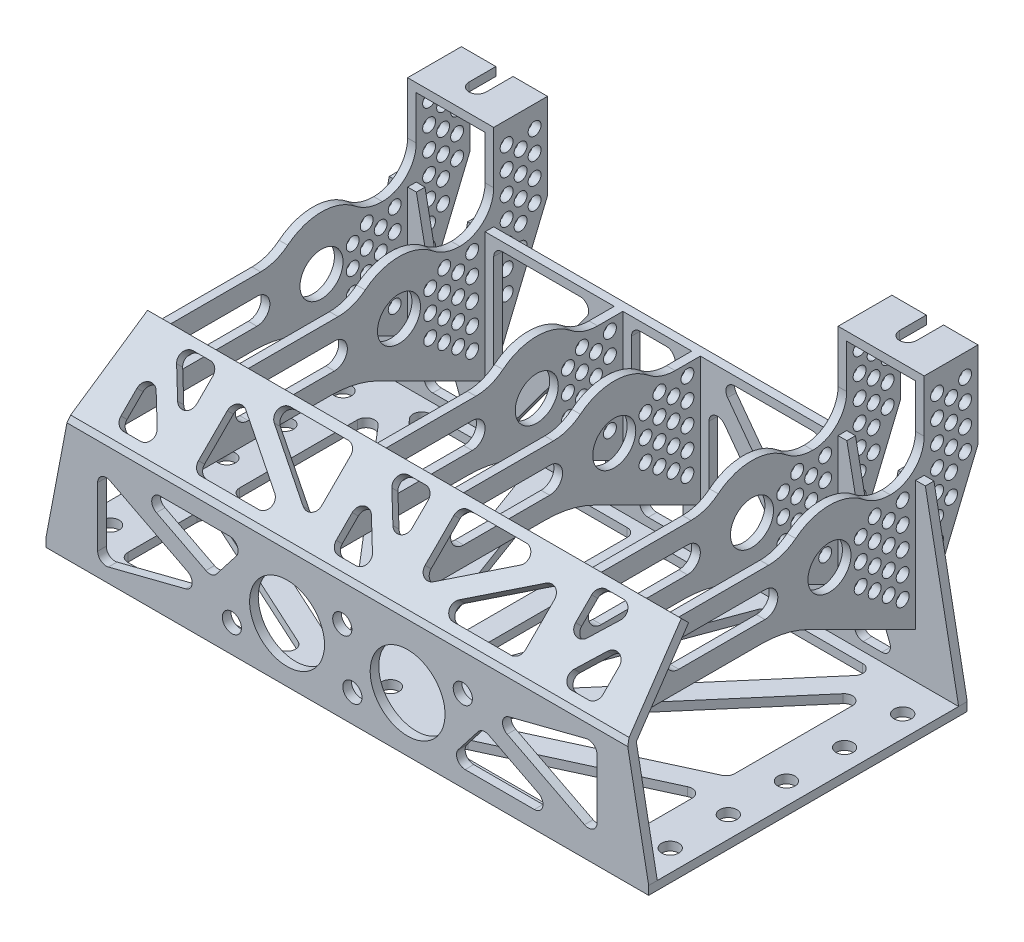
from build123d import *

# Parameters (mm, degrees)
BOSS_EXTRUDE1_START      = 16
SKETCH1_R                = 10
BOSS_EXTRUDE1_DEPTH      = 4
SKETCH2_W                = 280
SKETCH2_H                = 85
BOSS_EXTRUDE2_DEPTH      = 4
SKETCH3_R                = 17.4
CUT_EXTRUDE1_DEPTH       = 10
SKETCH4_R                = 17.4
SKETCH4_R_2              = 4.45
CUT_EXTRUDE2_DEPTH       = 10
LPATTERN2_COUNT          = 2
LPATTERN2_PITCH          = 64
LPATTERN2_COL_COUNT      = 2
LPATTERN2_COL_PITCH      = 100
BOSS_EXTRUDE3_START      = 32
SKETCH5_R                = 10
BOSS_EXTRUDE3_DEPTH      = 4
BOSS_EXTRUDE4_START      = 36
SKETCH6_R                = 10
BOSS_EXTRUDE4_DEPTH      = 4
CUT_EXTRUDE3_DEPTH       = 188.92551716
CUT_EXTRUDE3_DEPTH_BACK  = 188.92551716
BOSS_EXTRUDE5_DEPTH      = 140
SKETCH9_W                = 280
SKETCH9_H                = 85
BOSS_EXTRUDE6_DEPTH      = 4
SKETCH10_W               = 280
SKETCH10_H               = 148
BOSS_EXTRUDE7_DEPTH      = 4
CUT_EXTRUDE4_DEPTH       = 4
CUT_EXTRUDE5_DEPTH       = 4
CUT_EXTRUDE6_DEPTH       = 4
SKETCH14_R               = 4
CUT_EXTRUDE7_DEPTH       = 4
CUT_EXTRUDE8_DEPTH       = 10
BOSS_EXTRUDE8_START      = 80
SKETCH16_R               = 3
BOSS_EXTRUDE8_DEPTH      = 4
LPATTERN3_COUNT          = 2
LPATTERN3_PITCH          = 36
BOSS_EXTRUDE9_DEPTH      = 4
MIRROR2_START            = 80
MIRROR2_COPY_1_SKETCH_R  = 3
MIRROR2_COPY_1_DEPTH     = 4
CUT_EXTRUDE9_DEPTH       = 188.92551716
CUT_EXTRUDE9_DEPTH_BACK  = 188.92551716
SKETCH18_R               = 3
CUT_EXTRUDE10_DEPTH      = 188.92551716
CUT_EXTRUDE10_DEPTH_BACK = 188.92551716


with BuildPart() as part:
    # Sketch1 → Boss-Extrude1 (new body)
    with BuildSketch(Plane(origin=(0, 0, 0), x_dir=(0, 0, -1), z_dir=(1, 0, 0)).offset(BOSS_EXTRUDE1_START)):
        with BuildLine():
            Line((40, 15), (28.284271247, 15))
            ThreePointArc((28.284271247, 15), (21.617604581, 16.143819168), (15.713484026, 19.444444444))
            ThreePointArc((15.713484026, 19.444444444), (0, 25), (-15.713484026, 19.444444444))
            ThreePointArc((-15.713484026, 19.444444444), (-21.617604581, 16.143819168), (-28.284271247, 15))
            Line((-28.284271247, 15), (-100, 15))
            Line((-100, 15), (-100, -15))
            Line((-100, -15), (-31.803398875, -15))
            ThreePointArc((-31.803398875, -15), (-20.315752848, -16.337550527), (-9.4427191, -20.27864045))
            Line((-9.4427191, -20.27864045), (40, -45))
            Line((40, -45), (40, -15))
            Line((40, -15), (40, 15))
        make_face()
        Circle(SKETCH1_R, mode=Mode.SUBTRACT)
        with BuildLine():
            Line((-30, -6), (-60, -6))
            ThreePointArc((-60, -6), (-66, 0), (-60, 6))
            Line((-60, 6), (-30, 6))
            ThreePointArc((-30, 6), (-24, 0), (-30, -6))
        make_face(mode=Mode.SUBTRACT)
    boss_extrude1 = extrude(amount=BOSS_EXTRUDE1_DEPTH)


with BuildPart() as body_2:
    # Mirror1: mirrored copy
    add(part.part.mirror(Plane(origin=(0, 0, 0), x_dir=(0, 0, 1), z_dir=(1, 0, 0))))


with BuildPart() as part_1:
    add(part.part)

    add(body_2.part)  # Boss-Extrude2 merges body 2
    # Sketch2 → Boss-Extrude2 (add)
    with BuildSketch(Plane.XY.offset(100)):
        with Locations((0, -27.5)):
            Rectangle(SKETCH2_W, SKETCH2_H)
    extrude(amount=BOSS_EXTRUDE2_DEPTH)

    # Sketch3 → Cut-Extrude1 (cut)
    with BuildSketch(Plane.XY.offset(104)):
        with Locations((-28, -44.5)):
            Circle(SKETCH3_R)
        with Locations(Location((28, -44.5, 0), (0, 0, 180))):
            Circle(SKETCH3_R)
    extrude(amount=-CUT_EXTRUDE1_DEPTH, mode=Mode.SUBTRACT)

    # Sketch4 → Cut-Extrude2 (cut)
    with BuildSketch(Plane.XY.offset(104)):
        with Locations(Location((28, -44.5, 0), (0, 0, 180))):
            Circle(SKETCH4_R)
        with Locations((-28, -44.5)):
            Circle(SKETCH4_R)
        with Locations((-53.64371268, -57.05)):
            Circle(SKETCH4_R_2)
        with Locations((-2.35628732, -31.95)):
            Circle(SKETCH4_R_2)
        with Locations((2.35628732, -57.05)):
            Circle(SKETCH4_R_2)
        with Locations((53.64371268, -31.95)):
            Circle(SKETCH4_R_2)
    extrude(amount=-CUT_EXTRUDE2_DEPTH, mode=Mode.SUBTRACT)

    # LPattern2: Boss-Extrude1 ×2
    with Locations(*[(i * LPATTERN2_PITCH, 0, 0) for i in range(1, LPATTERN2_COUNT)]):
        add(boss_extrude1)

    # LPattern2 col: Boss-Extrude1 ×2
    with Locations(*[(-i * LPATTERN2_COL_PITCH, 0, 0) for i in range(1, LPATTERN2_COL_COUNT)]):
        add(boss_extrude1)

    # Sketch5 → Boss-Extrude3 (add)
    with BuildSketch(Plane(origin=(84, 0, 0), x_dir=(0, 0, -1), z_dir=(1, 0, 0)).offset(BOSS_EXTRUDE3_START)):
        with BuildLine():
            Line((40, -45), (40, 15))
            Line((40, 15), (28.284271247, 15))
            ThreePointArc((28.284271247, 15), (21.617604581, 16.143819168), (15.713484026, 19.444444444))
            ThreePointArc((15.713484026, 19.444444444), (0, 25), (-15.713484026, 19.444444444))
            ThreePointArc((-15.713484026, 19.444444444), (-21.617604581, 16.143819168), (-28.284271247, 15))
            Line((-28.284271247, 15), (-100, 15))
            Line((-100, 15), (-100, -15))
            Line((-100, -15), (-31.803398875, -15))
            ThreePointArc((-31.803398875, -15), (-20.315752848, -16.337550527), (-9.4427191, -20.27864045))
            Line((-9.4427191, -20.27864045), (40, -45))
        make_face()
        Circle(SKETCH5_R, mode=Mode.SUBTRACT)
        with BuildLine():
            Line((-60, -6), (-30, -6))
            ThreePointArc((-30, -6), (-24, 0), (-30, 6))
            Line((-30, 6), (-60, 6))
            ThreePointArc((-60, 6), (-66, 0), (-60, -6))
        make_face(mode=Mode.SUBTRACT)
    extrude(amount=BOSS_EXTRUDE3_DEPTH)

    # Sketch6 → Boss-Extrude4 (add)
    with BuildSketch(Plane.ZY.offset(84).offset(BOSS_EXTRUDE4_START)):
        with BuildLine():
            Line((-40, 15), (-40, -45))
            Line((-40, -45), (9.4427191, -20.27864045))
            ThreePointArc((9.4427191, -20.27864045), (20.315752848, -16.337550527), (31.803398875, -15))
            Line((31.803398875, -15), (100, -15))
            Line((100, -15), (100, 15))
            Line((100, 15), (28.284271247, 15))
            ThreePointArc((28.284271247, 15), (21.617604581, 16.143819168), (15.713484026, 19.444444444))
            ThreePointArc((15.713484026, 19.444444444), (0, 25), (-15.713484026, 19.444444444))
            ThreePointArc((-15.713484026, 19.444444444), (-21.617604581, 16.143819168), (-28.284271247, 15))
            Line((-28.284271247, 15), (-40, 15))
        make_face()
        with Locations(Location((0, 0, 0), (0, 0, 180))):
            Circle(SKETCH6_R, mode=Mode.SUBTRACT)
        with BuildLine():
            Line((30, 6), (60, 6))
            ThreePointArc((60, 6), (66, 0), (60, -6))
            Line((60, -6), (30, -6))
            ThreePointArc((30, -6), (24, 0), (30, 6))
        make_face(mode=Mode.SUBTRACT)
    extrude(amount=-BOSS_EXTRUDE4_DEPTH)

    # Sketch7 → Cut-Extrude3 (cut, two sides: drawn at the far end of the back side and taken through both)
    with BuildSketch(Plane(origin=(0, 0, 0), x_dir=(0, 0, -1), z_dir=(1, 0, 0)).offset(-CUT_EXTRUDE3_DEPTH_BACK)):
        Polygon((-100, -15), (-70, 15), (-68.891417533, 31.702063233), (-121.475487847, 31.702063233), (-121.475487847, -15), align=None)
    extrude(amount=CUT_EXTRUDE3_DEPTH + CUT_EXTRUDE3_DEPTH_BACK, mode=Mode.SUBTRACT)


with BuildPart() as cut_extrude3_piece_1:
    # of the separate pieces the step leaves, piece 1, a body of its own (cut_extrude3_pieces)
    add(part_1.part.solids().sort_by_distance((-140, -15, 100))[0])



with BuildPart() as cut_extrude3_piece_2:
    # of the separate pieces the step leaves, piece 2, a body of its own (cut_extrude3_pieces)
    add(part_1.part.solids().sort_by_distance((-120, 15, 70))[0])


with BuildPart() as cut_extrude3_piece_3:
    # of the separate pieces the step leaves, piece 3, a body of its own (cut_extrude3_pieces)
    add(part_1.part.solids().sort_by_distance((16, 15, 70))[0])


with BuildPart() as cut_extrude3_piece_4:
    # of the separate pieces the step leaves, piece 4, a body of its own (cut_extrude3_pieces)
    add(part_1.part.solids().sort_by_distance((80, 15, 70))[0])


with BuildPart() as cut_extrude3_piece_5:
    # of the separate pieces the step leaves, piece 5, a body of its own (cut_extrude3_pieces)
    add(part_1.part.solids().sort_by_distance((-84, 15, 28.284271247))[0])


with BuildPart() as cut_extrude3_piece_6:
    # of the separate pieces the step leaves, piece 6, a body of its own (cut_extrude3_pieces)
    add(part_1.part.solids().sort_by_distance((-20, 15, 28.284271247))[0])


with BuildPart() as cut_extrude3_piece_7:
    # of the separate pieces the step leaves, piece 7, a body of its own (cut_extrude3_pieces)
    add(part_1.part.solids().sort_by_distance((116, 15, 70))[0])


with BuildPart() as cut_extrude3_piece_1_1:
    add(cut_extrude3_piece_1.part)

    add(cut_extrude3_piece_2.part)  # Boss-Extrude5 merges Cut-Extrude3 piece 2

    add(cut_extrude3_piece_3.part)  # Boss-Extrude5 merges Cut-Extrude3 piece 3

    add(cut_extrude3_piece_4.part)  # Boss-Extrude5 merges Cut-Extrude3 piece 4

    add(cut_extrude3_piece_5.part)  # Boss-Extrude5 merges Cut-Extrude3 piece 5

    add(cut_extrude3_piece_6.part)  # Boss-Extrude5 merges Cut-Extrude3 piece 6

    add(cut_extrude3_piece_7.part)  # Boss-Extrude5 merges Cut-Extrude3 piece 7
    # Sketch8 → Boss-Extrude5 (add, symmetric)
    with BuildSketch(Plane(origin=(0, 0, 0), x_dir=(0, 0, -1), z_dir=(1, 0, 0))):
        Polygon((-100, -15), (-70, 15), (-72.828427125, 17.828427125), (-102.828427125, -12.171572875), (-104, -15), align=None)
    extrude(amount=BOSS_EXTRUDE5_DEPTH, both=True)

    # Sketch9 → Boss-Extrude6 (add)
    with BuildSketch(Plane(origin=(0, 0, -40), x_dir=(-1, 0, 0), z_dir=(0, 0, -1))):
        with Locations((0, -27.5)):
            Rectangle(SKETCH9_W, SKETCH9_H)
    extrude(amount=BOSS_EXTRUDE6_DEPTH)

    # Sketch10 → Boss-Extrude7 (add)
    with BuildSketch(Plane.XZ.offset(70)):
        with Locations((0, 30)):
            Rectangle(SKETCH10_W, SKETCH10_H)
    extrude(amount=-BOSS_EXTRUDE7_DEPTH)

    # Sketch11 → Cut-Extrude4 (cut)
    with BuildSketch(Plane(origin=(0, 45.328427125, 45.328427125), x_dir=(1, 0, 0), z_dir=(0, 0.7071067811865476, 0.7071067811865475))):
        with BuildLine():
            Line((-69.690598923, -51.079699862), (-42.860713883, -70.051293513))
            ThreePointArc((-42.860713883, -70.051293513), (-41.358032504, -74.528901623), (-45.17011496, -77.317279836))
            Line((-45.17011496, -77.317279836), (-72, -77.317279836))
            ThreePointArc((-72, -77.317279836), (-74.828427125, -76.145706961), (-76, -73.317279836))
            Line((-76, -73.317279836), (-76, -54.345686186))
            ThreePointArc((-76, -54.345686186), (-73.838803374, -50.79339085), (-69.690598923, -51.079699862))
        make_face()
        with BuildLine():
            Line((-57.139286117, -50.156859289), (-30.309401077, -69.12845294))
            ThreePointArc((-30.309401077, -69.12845294), (-26.161196626, -69.414761952), (-24, -65.862466616))
            Line((-24, -65.862466616), (-24, -46.890872965))
            ThreePointArc((-24, -46.890872965), (-25.171572875, -44.062445841), (-28, -42.890872965))
            Line((-28, -42.890872965), (-54.82988504, -42.890872965))
            ThreePointArc((-54.82988504, -42.890872965), (-58.641967496, -45.679251179), (-57.139286117, -50.156859289))
        make_face()
        with BuildLine():
            Line((76, -54.345686186), (76, -73.317279836))
            ThreePointArc((76, -73.317279836), (74.828427125, -76.145706961), (72, -77.317279836))
            Line((72, -77.317279836), (45.17011496, -77.317279836))
            ThreePointArc((45.17011496, -77.317279836), (41.358032504, -74.528901623), (42.860713883, -70.051293513))
            Line((42.860713883, -70.051293513), (69.690598923, -51.079699862))
            ThreePointArc((69.690598923, -51.079699862), (73.838803374, -50.79339085), (76, -54.345686186))
        make_face()
        with BuildLine():
            Line((57.139286117, -50.156859289), (30.309401077, -69.12845294))
            ThreePointArc((30.309401077, -69.12845294), (26.161196626, -69.414761952), (24, -65.862466616))
            Line((24, -65.862466616), (24, -46.890872965))
            ThreePointArc((24, -46.890872965), (25.171572875, -44.062445841), (28, -42.890872965))
            Line((28, -42.890872965), (54.82988504, -42.890872965))
            ThreePointArc((54.82988504, -42.890872965), (58.641967496, -45.679251179), (57.139286117, -50.156859289))
        make_face()
        with BuildLine():
            Line((-112, -62.782804939), (-112, -73.317279836))
            ThreePointArc((-112, -73.317279836), (-110.828427125, -76.145706961), (-108, -77.317279836))
            Line((-108, -77.317279836), (-100.054401454, -77.317279836))
            ThreePointArc((-100.054401454, -77.317279836), (-96.474269676, -75.101279963), (-96.860923682, -70.908608062))
            Line((-96.860923682, -70.908608062), (-104.806522228, -60.374133164))
            ThreePointArc((-104.806522228, -60.374133164), (-109.270056871, -58.989790894), (-112, -62.782804939))
        make_face()
        with BuildLine():
            Line((-88, -46.890872965), (-88, -57.425347863))
            ThreePointArc((-88, -57.425347863), (-90.729943129, -61.218361908), (-95.193477772, -59.834019637))
            Line((-95.193477772, -59.834019637), (-103.139076318, -49.29954474))
            ThreePointArc((-103.139076318, -49.29954474), (-103.525730324, -45.106872839), (-99.945598546, -42.890872965))
            Line((-99.945598546, -42.890872965), (-92, -42.890872965))
            ThreePointArc((-92, -42.890872965), (-89.171572875, -44.062445841), (-88, -46.890872965))
        make_face()
        with BuildLine():
            Line((96.860923682, -70.908608062), (104.806522228, -60.374133164))
            ThreePointArc((104.806522228, -60.374133164), (109.270056871, -58.989790894), (112, -62.782804939))
            Line((112, -62.782804939), (112, -73.317279836))
            ThreePointArc((112, -73.317279836), (110.828427125, -76.145706961), (108, -77.317279836))
            Line((108, -77.317279836), (100.054401454, -77.317279836))
            ThreePointArc((100.054401454, -77.317279836), (96.474269676, -75.101279963), (96.860923682, -70.908608062))
        make_face()
        with BuildLine():
            Line((95.193477772, -59.834019637), (103.139076318, -49.29954474))
            ThreePointArc((103.139076318, -49.29954474), (103.525730324, -45.106872839), (99.945598546, -42.890872965))
            Line((99.945598546, -42.890872965), (92, -42.890872965))
            ThreePointArc((92, -42.890872965), (89.171572875, -44.062445841), (88, -46.890872965))
            Line((88, -46.890872965), (88, -57.425347863))
            ThreePointArc((88, -57.425347863), (90.729943129, -61.218361908), (95.193477772, -59.834019637))
        make_face()
        with BuildLine():
            Line((12, -46.890872965), (12, -57.425347863))
            ThreePointArc((12, -57.425347863), (9.270056871, -61.218361908), (4.806522228, -59.834019637))
            Line((4.806522228, -59.834019637), (-3.139076318, -49.29954474))
            ThreePointArc((-3.139076318, -49.29954474), (-3.525730324, -45.106872839), (0.054401454, -42.890872965))
            Line((0.054401454, -42.890872965), (8, -42.890872965))
            ThreePointArc((8, -42.890872965), (10.828427125, -44.062445841), (12, -46.890872965))
        make_face()
        with BuildLine():
            Line((-12, -62.782804939), (-12, -73.317279836))
            ThreePointArc((-12, -73.317279836), (-10.828427125, -76.145706961), (-8, -77.317279836))
            Line((-8, -77.317279836), (-0.054401454, -77.317279836))
            ThreePointArc((-0.054401454, -77.317279836), (3.525730324, -75.101279963), (3.139076318, -70.908608062))
            Line((3.139076318, -70.908608062), (-4.806522228, -60.374133164))
            ThreePointArc((-4.806522228, -60.374133164), (-9.270056871, -58.989790894), (-12, -62.782804939))
        make_face()
    extrude(amount=-CUT_EXTRUDE4_DEPTH, mode=Mode.SUBTRACT)

    # Sketch12 → Cut-Extrude5 (cut)
    with BuildSketch(Plane.XY.offset(104)):
        with BuildLine():
            Line((110.173835996, -56.461926372), (74.25982254, -38.033044837))
            ThreePointArc((74.25982254, -38.033044837), (72.111051039, -34.027147281), (75.09601661, -30.598676086))
            Line((75.09601661, -30.598676086), (111.010030066, -21.424827569))
            ThreePointArc((111.010030066, -21.424827569), (114.453581083, -22.14128254), (116, -25.300386823))
            Line((116, -25.300386823), (116, -52.903116876))
            ThreePointArc((116, -52.903116876), (114.08510719, -56.316667521), (110.173835996, -56.461926372))
        make_face()
        with BuildLine():
            Line((86.886612683, -62), (54.740084668, -62))
            ThreePointArc((54.740084668, -62), (51.147270282, -59.758318739), (51.581428238, -55.545842394))
            Line((51.581428238, -55.545842394), (60.744641008, -43.752206618))
            ThreePointArc((60.744641008, -43.752206618), (63.03787964, -42.30110469), (65.729461443, -42.647554728))
            Line((65.729461443, -42.647554728), (88.712776687, -54.441190504))
            ThreePointArc((88.712776687, -54.441190504), (90.774750926, -58.939351376), (86.886612683, -62))
        make_face()
        with BuildLine():
            Line((-86.886612683, -22.808268985), (-54.740084668, -22.808268985))
            ThreePointArc((-54.740084668, -22.808268985), (-51.147270282, -25.049950246), (-51.581428238, -29.262426591))
            Line((-51.581428238, -29.262426591), (-60.744641008, -41.056062367))
            ThreePointArc((-60.744641008, -41.056062367), (-63.03787964, -42.507164296), (-65.729461443, -42.160714257))
            Line((-65.729461443, -42.160714257), (-88.712776687, -30.367078481))
            ThreePointArc((-88.712776687, -30.367078481), (-90.774750926, -25.868917609), (-86.886612683, -22.808268985))
        make_face()
        with BuildLine():
            Line((-110.173835996, -28.346342613), (-74.25982254, -46.775224149))
            ThreePointArc((-74.25982254, -46.775224149), (-72.111051039, -50.781121705), (-75.09601661, -54.209592899))
            Line((-75.09601661, -54.209592899), (-111.010030066, -63.383441417))
            ThreePointArc((-111.010030066, -63.383441417), (-114.453581083, -62.666986445), (-116, -59.507882163))
            Line((-116, -59.507882163), (-116, -31.905152109))
            ThreePointArc((-116, -31.905152109), (-114.08510719, -28.491601464), (-110.173835996, -28.346342613))
        make_face()
    extrude(amount=-CUT_EXTRUDE5_DEPTH, mode=Mode.SUBTRACT)

    # Sketch13 → Cut-Extrude6 (cut)
    with BuildSketch(Plane(origin=(0, 0, -44), x_dir=(-1, 0, 0), z_dir=(0, 0, -1))):
        with BuildLine():
            Line((-76, 7), (-76, -41.759761907))
            ThreePointArc((-76, -41.759761907), (-73.253611763, -45.558242859), (-68.785771227, -44.140672109))
            Line((-68.785771227, -44.140672109), (-32.667429073, 4.619089797))
            ThreePointArc((-32.667429073, 4.619089797), (-32.309288828, 8.799494261), (-35.881657847, 11))
            Line((-35.881657847, 11), (-72, 11))
            ThreePointArc((-72, 11), (-74.828427125, 9.828427125), (-76, 7))
        make_face()
        with BuildLine():
            Line((-67.332570927, -55.619089797), (-31.214228773, -6.859327891))
            ThreePointArc((-31.214228773, -6.859327891), (-26.746388237, -5.441757141), (-24, -9.240238093))
            Line((-24, -9.240238093), (-24, -58))
            ThreePointArc((-24, -58), (-25.171572875, -60.828427125), (-28, -62))
            Line((-28, -62), (-64.118342153, -62))
            ThreePointArc((-64.118342153, -62), (-67.690711172, -59.799494261), (-67.332570927, -55.619089797))
        make_face()
        with BuildLine():
            Line((-12, -27.02297637), (-12, -58))
            ThreePointArc((-12, -58), (-10.828427125, -60.828427125), (-8, -62))
            Line((-8, -62), (4.237836496, -62))
            ThreePointArc((4.237836496, -62), (7.545316439, -60.249572499), (7.958044456, -56.530288213))
            Line((7.958044456, -56.530288213), (-4.27979204, -25.553264583))
            ThreePointArc((-4.27979204, -25.553264583), (-8.748053528, -23.093546905), (-12, -27.02297637))
        make_face()
        with BuildLine():
            Line((4.27979204, -25.446735417), (-7.958044456, 5.530288213))
            ThreePointArc((-7.958044456, 5.530288213), (-7.545316439, 9.249572499), (-4.237836496, 11))
            Line((-4.237836496, 11), (8, 11))
            ThreePointArc((8, 11), (10.828427125, 9.828427125), (12, 7))
            Line((12, 7), (12, -23.97702363))
            ThreePointArc((12, -23.97702363), (8.748053528, -27.906453095), (4.27979204, -25.446735417))
        make_face()
        with BuildLine():
            Line((64.118342153, -62), (28, -62))
            ThreePointArc((28, -62), (25.171572875, -60.828427125), (24, -58))
            Line((24, -58), (24, -9.240238093))
            ThreePointArc((24, -9.240238093), (26.746388237, -5.441757141), (31.214228773, -6.859327891))
            Line((31.214228773, -6.859327891), (67.332570927, -55.619089797))
            ThreePointArc((67.332570927, -55.619089797), (67.690711172, -59.799494261), (64.118342153, -62))
        make_face()
        with BuildLine():
            Line((72, 11), (35.881657847, 11))
            ThreePointArc((35.881657847, 11), (32.309288828, 8.799494261), (32.667429073, 4.619089797))
            Line((32.667429073, 4.619089797), (68.785771227, -44.140672109))
            ThreePointArc((68.785771227, -44.140672109), (73.253611763, -45.558242859), (76, -41.759761907))
            Line((76, -41.759761907), (76, 7))
            ThreePointArc((76, 7), (74.828427125, 9.828427125), (72, 11))
        make_face()
    extrude(amount=-CUT_EXTRUDE6_DEPTH, mode=Mode.SUBTRACT)

    # Sketch14 → Cut-Extrude7 (cut)
    with BuildSketch(Plane.XZ.offset(70)):
        with Locations((0, 84)):
            Circle(SKETCH14_R)
        with Locations((-130, 84)):
            Circle(SKETCH14_R)
        with Locations((-130, 57)):
            Circle(SKETCH14_R)
        with Locations((-130, 30)):
            Circle(SKETCH14_R)
        with Locations((-130, 3)):
            Circle(SKETCH14_R)
        with Locations((-130, -24)):
            Circle(SKETCH14_R)
        with Locations(Location((130, -24, 0), (0, 0, 180))):
            Circle(SKETCH14_R)
        with Locations(Location((130, 3, 0), (0, 0, 180))):
            Circle(SKETCH14_R)
        with Locations(Location((130, 30, 0), (0, 0, 180))):
            Circle(SKETCH14_R)
        with Locations(Location((130, 57, 0), (0, 0, 180))):
            Circle(SKETCH14_R)
        with Locations(Location((130, 84, 0), (0, 0, 180))):
            Circle(SKETCH14_R)
        with BuildLine():
            Line((-5, -31), (-5, 55.314158673))
            ThreePointArc((-5, 55.314158673), (-7.471322599, 58.267207979), (-10.813666804, 56.354965628))
            Line((-10.813666804, 56.354965628), (-42.61390821, -29.612257394))
            ThreePointArc((-42.61390821, -29.612257394), (-42.144955892, -33.285719753), (-38.862352472, -35))
            Line((-38.862352472, -35), (-9, -35))
            ThreePointArc((-9, -35), (-6.171572875, -33.828427125), (-5, -31))
        make_face()
        with BuildLine():
            Line((-39.436189725, 87.365929523), (-109.328613819, 55.220919539))
            ThreePointArc((-109.328613819, 55.220919539), (-113.158061083, 55.487086757), (-115, 58.854990016))
            Line((-115, 58.854990016), (-115, 91))
            ThreePointArc((-115, 91), (-113.828427125, 93.828427125), (-111, 95))
            Line((-111, 95), (-41.107575906, 95))
            ThreePointArc((-41.107575906, 95), (-37.200129047, 91.855487607), (-39.436189725, 87.365929523))
        make_face()
        with BuildLine():
            Line((-107.962973591, -18.273848808), (-30.547292181, 72.044446169))
            ThreePointArc((-30.547292181, 72.044446169), (-30.391824041, 77.057586466), (-35.255704772, 78.281682141))
            Line((-35.255704772, 78.281682141), (-112.671386181, 42.676566364))
            ThreePointArc((-112.671386181, 42.676566364), (-114.367903259, 41.20055697), (-115, 39.042495887))
            Line((-115, 39.042495887), (-115, -15.670683314))
            ThreePointArc((-115, -15.670683314), (-112.387784991, -19.422223374), (-107.962973591, -18.273848808))
        make_face()
        with BuildLine():
            Line((-20.191546501, 59.82705158), (-54.302834655, -32.387742606))
            ThreePointArc((-54.302834655, -32.387742606), (-55.768670641, -34.28260342), (-58.054390394, -35))
            Line((-58.054390394, -35), (-100.432014269, -35))
            ThreePointArc((-100.432014269, -35), (-104.066065863, -32.671427238), (-103.469040679, -28.396834506))
            Line((-103.469040679, -28.396834506), (-25.282983111, 62.820232656))
            ThreePointArc((-25.282983111, 62.820232656), (-21.484825316, 63.454056587), (-20.191546501, 59.82705158))
        make_face()
        with BuildLine():
            Line((38.862352472, -35), (9, -35))
            ThreePointArc((9, -35), (6.171572875, -33.828427125), (5, -31))
            Line((5, -31), (5, 55.314158673))
            ThreePointArc((5, 55.314158673), (7.471322599, 58.267207979), (10.813666804, 56.354965628))
            Line((10.813666804, 56.354965628), (42.61390821, -29.612257394))
            ThreePointArc((42.61390821, -29.612257394), (42.144955892, -33.285719753), (38.862352472, -35))
        make_face()
        with BuildLine():
            Line((103.469040679, -28.396834506), (25.282983111, 62.820232656))
            ThreePointArc((25.282983111, 62.820232656), (21.484825316, 63.454056587), (20.191546501, 59.82705158))
            Line((20.191546501, 59.82705158), (54.302834655, -32.387742606))
            ThreePointArc((54.302834655, -32.387742606), (55.768670641, -34.28260342), (58.054390394, -35))
            Line((58.054390394, -35), (100.432014269, -35))
            ThreePointArc((100.432014269, -35), (104.066065863, -32.671427238), (103.469040679, -28.396834506))
        make_face()
        with BuildLine():
            Line((115, 39.042495887), (115, -15.670683314))
            ThreePointArc((115, -15.670683314), (112.387784991, -19.422223374), (107.962973591, -18.273848808))
            Line((107.962973591, -18.273848808), (30.547292181, 72.044446169))
            ThreePointArc((30.547292181, 72.044446169), (30.391824041, 77.057586466), (35.255704772, 78.281682141))
            Line((35.255704772, 78.281682141), (112.671386181, 42.676566364))
            ThreePointArc((112.671386181, 42.676566364), (114.367903259, 41.20055697), (115, 39.042495887))
        make_face()
        with BuildLine():
            Line((111, 95), (41.107575906, 95))
            ThreePointArc((41.107575906, 95), (37.200129047, 91.855487607), (39.436189725, 87.365929523))
            Line((39.436189725, 87.365929523), (109.328613819, 55.220919539))
            ThreePointArc((109.328613819, 55.220919539), (113.158061083, 55.487086757), (115, 58.854990016))
            Line((115, 58.854990016), (115, 91))
            ThreePointArc((115, 91), (113.828427125, 93.828427125), (111, 95))
        make_face()
    extrude(amount=-CUT_EXTRUDE7_DEPTH, mode=Mode.SUBTRACT)

    # Sketch15 → Cut-Extrude8 (cut)
    with BuildSketch(Plane(origin=(0, 0, -44), x_dir=(-1, 0, 0), z_dir=(0, 0, -1))):
        with BuildLine():
            Line((-112.075825031, 15.775145673), (-103.924174969, -25.492582768))
            ThreePointArc((-103.924174969, -25.492582768), (-100, -28.717437095), (-96.075825031, -25.492582768))
            Line((-96.075825031, -25.492582768), (-87.924174969, 15.775145673))
            Line((-87.924174969, 15.775145673), (-112.075825031, 15.775145673))
        make_face()
        with BuildLine():
            Line((-104.319579721, -62), (-95.680420279, -62))
            ThreePointArc((-95.680420279, -62), (-92.380262568, -60.260300662), (-91.950745949, -56.554479541))
            Line((-91.950745949, -56.554479541), (-96.270325671, -45.409271944))
            ThreePointArc((-96.270325671, -45.409271944), (-100, -42.854792402), (-103.729674329, -45.409271944))
            Line((-103.729674329, -45.409271944), (-108.049254051, -56.554479541))
            ThreePointArc((-108.049254051, -56.554479541), (-107.619737432, -60.260300662), (-104.319579721, -62))
        make_face()
        with BuildLine():
            Line((103.729674329, -45.409271944), (108.049254051, -56.554479541))
            ThreePointArc((108.049254051, -56.554479541), (107.619737432, -60.260300662), (104.319579721, -62))
            Line((104.319579721, -62), (95.680420279, -62))
            ThreePointArc((95.680420279, -62), (92.380262568, -60.260300662), (91.950745949, -56.554479541))
            Line((91.950745949, -56.554479541), (96.270325671, -45.409271944))
            ThreePointArc((96.270325671, -45.409271944), (100, -42.854792402), (103.729674329, -45.409271944))
        make_face()
        with BuildLine():
            Line((112.075825031, 15.775145673), (103.924174969, -25.492582768))
            ThreePointArc((103.924174969, -25.492582768), (100, -28.717437095), (96.075825031, -25.492582768))
            Line((96.075825031, -25.492582768), (87.924174969, 15.775145673))
            Line((87.924174969, 15.775145673), (112.075825031, 15.775145673))
        make_face()
    extrude(amount=-CUT_EXTRUDE8_DEPTH, mode=Mode.SUBTRACT)

    # Sketch16 → Boss-Extrude8 (add)
    with BuildSketch(Plane(origin=(0, 0, 0), x_dir=(0, 0, -1), z_dir=(1, 0, 0)).offset(BOSS_EXTRUDE8_START)):
        with BuildLine():
            Line((44, 30.715728753), (44, 55))
            Line((44, 55), (69, 55))
            Line((69, 55), (69, 15))
            Line((69, 15), (44, -45))
            Line((44, -45), (44, 15))
            Line((44, 15), (28.284271247, 15))
            ThreePointArc((28.284271247, 15), (39.39696962, 19.60303038), (44, 30.715728753))
        make_face()
        with Locations((50, 45)):
            Circle(SKETCH16_R, mode=Mode.SUBTRACT)
        with Locations((50, 35)):
            Circle(SKETCH16_R, mode=Mode.SUBTRACT)
        with Locations((50, 25)):
            Circle(SKETCH16_R, mode=Mode.SUBTRACT)
        with Locations((50, 15)):
            Circle(SKETCH16_R, mode=Mode.SUBTRACT)
        with Locations((50, 5)):
            Circle(SKETCH16_R, mode=Mode.SUBTRACT)
        with Locations((50, -5)):
            Circle(SKETCH16_R, mode=Mode.SUBTRACT)
        with Locations((50, -15)):
            Circle(SKETCH16_R, mode=Mode.SUBTRACT)
        with Locations((56.5, 40)):
            Circle(SKETCH16_R, mode=Mode.SUBTRACT)
        with Locations((56.5, 30)):
            Circle(SKETCH16_R, mode=Mode.SUBTRACT)
        with Locations((56.5, 20)):
            Circle(SKETCH16_R, mode=Mode.SUBTRACT)
        with Locations((56.5, 10)):
            Circle(SKETCH16_R, mode=Mode.SUBTRACT)
        with Locations((56.5, 0)):
            Circle(SKETCH16_R, mode=Mode.SUBTRACT)
        with Locations(Location((63, 15, 0), (0, 0, 180))):
            Circle(SKETCH16_R, mode=Mode.SUBTRACT)
        with Locations(Location((63, 25, 0), (0, 0, 180))):
            Circle(SKETCH16_R, mode=Mode.SUBTRACT)
        with Locations(Location((63, 35, 0), (0, 0, 180))):
            Circle(SKETCH16_R, mode=Mode.SUBTRACT)
        with Locations(Location((63, 45, 0), (0, 0, 180))):
            Circle(SKETCH16_R, mode=Mode.SUBTRACT)
    boss_extrude8 = extrude(amount=BOSS_EXTRUDE8_DEPTH)

    # LPattern3: Boss-Extrude8 ×2
    with Locations(*[(i * LPATTERN3_PITCH, 0, 0) for i in range(1, LPATTERN3_COUNT)]):
        add(boss_extrude8)

    # Sketch17 → Boss-Extrude9 (add)
    with BuildSketch(Plane(origin=(0, 55, 0), x_dir=(1, 0, 0), z_dir=(0, 1, 0))):
        with BuildLine():
            Line((80, 69), (96, 69))
            Line((96, 69), (96, 56.5))
            ThreePointArc((96, 56.5), (100, 52.5), (104, 56.5))
            Line((104, 56.5), (104, 69))
            Line((104, 69), (120, 69))
            Line((120, 69), (120, 44))
            Line((120, 44), (80, 44))
            Line((80, 44), (80, 69))
        make_face()
    boss_extrude9 = extrude(amount=-BOSS_EXTRUDE9_DEPTH)

    # Mirror2: Boss-Extrude8, Boss-Extrude9 across plane
    add(boss_extrude8.mirror(Plane(origin=(0, 0, 0), x_dir=(0, 0, 1), z_dir=(1, 0, 0))))
    add(boss_extrude9.mirror(Plane(origin=(0, 0, 0), x_dir=(0, 0, 1), z_dir=(1, 0, 0))))

    # Mirror2 copy 1 sketch → Mirror2 copy 1 (add)
    with BuildSketch(Plane(origin=(-36, 0, 0), x_dir=(0, 0, -1), z_dir=(-1, 0, 0)).offset(MIRROR2_START)):
        with BuildLine():
            Line((44, -30.715728753), (44, -55))
            Line((44, -55), (69, -55))
            Line((69, -55), (69, -15))
            Line((69, -15), (44, 45))
            Line((44, 45), (44, -15))
            Line((44, -15), (28.284271247, -15))
            ThreePointArc((28.284271247, -15), (39.39696962, -19.60303038), (44, -30.715728753))
        make_face()
        with Locations((50, -45)):
            Circle(MIRROR2_COPY_1_SKETCH_R, mode=Mode.SUBTRACT)
        with Locations((50, -35)):
            Circle(MIRROR2_COPY_1_SKETCH_R, mode=Mode.SUBTRACT)
        with Locations((50, -25)):
            Circle(MIRROR2_COPY_1_SKETCH_R, mode=Mode.SUBTRACT)
        with Locations((50, -15)):
            Circle(MIRROR2_COPY_1_SKETCH_R, mode=Mode.SUBTRACT)
        with Locations((50, -5)):
            Circle(MIRROR2_COPY_1_SKETCH_R, mode=Mode.SUBTRACT)
        with Locations((50, 5)):
            Circle(MIRROR2_COPY_1_SKETCH_R, mode=Mode.SUBTRACT)
        with Locations((50, 15)):
            Circle(MIRROR2_COPY_1_SKETCH_R, mode=Mode.SUBTRACT)
        with Locations((56.5, -40)):
            Circle(MIRROR2_COPY_1_SKETCH_R, mode=Mode.SUBTRACT)
        with Locations((56.5, -30)):
            Circle(MIRROR2_COPY_1_SKETCH_R, mode=Mode.SUBTRACT)
        with Locations((56.5, -20)):
            Circle(MIRROR2_COPY_1_SKETCH_R, mode=Mode.SUBTRACT)
        with Locations((56.5, -10)):
            Circle(MIRROR2_COPY_1_SKETCH_R, mode=Mode.SUBTRACT)
        with Locations((56.5, 0)):
            Circle(MIRROR2_COPY_1_SKETCH_R, mode=Mode.SUBTRACT)
        with Locations((63, -15)):
            Circle(MIRROR2_COPY_1_SKETCH_R, mode=Mode.SUBTRACT)
        with Locations((63, -25)):
            Circle(MIRROR2_COPY_1_SKETCH_R, mode=Mode.SUBTRACT)
        with Locations((63, -35)):
            Circle(MIRROR2_COPY_1_SKETCH_R, mode=Mode.SUBTRACT)
        with Locations((63, -45)):
            Circle(MIRROR2_COPY_1_SKETCH_R, mode=Mode.SUBTRACT)
    extrude(amount=MIRROR2_COPY_1_DEPTH)

    # Sketch18 → Cut-Extrude9 (cut, two sides: drawn at the far end of the back side and taken through both)
    with BuildSketch(Plane(origin=(0, 0, 0), x_dir=(0, 0, -1), z_dir=(1, 0, 0)).offset(-CUT_EXTRUDE9_DEPTH_BACK)):
        with BuildLine():
            Line((-60, 6), (-70, 6))
            ThreePointArc((-70, 6), (-76, 0), (-70, -6))
            Line((-70, -6), (-60, -6))
            Line((-60, -6), (-30, -6))
            ThreePointArc((-30, -6), (-24, 0), (-30, 6))
            Line((-30, 6), (-60, 6))
        make_face()
        with Locations(Location((27.5, 5, 0), (0, 0, 180))):
            Circle(SKETCH18_R)
        with Locations(Location((21, -20, 0), (0, 0, 180))):
            Circle(SKETCH18_R)
        with Locations(Location((21, 10, 0), (0, 0, 180))):
            Circle(SKETCH18_R)
        with Locations(Location((34, 10, 0), (0, 0, 180))):
            Circle(SKETCH18_R)
        with Locations(Location((34, 0, 0), (0, 0, 180))):
            Circle(SKETCH18_R)
        with Locations(Location((34, -10, 0), (0, 0, 180))):
            Circle(SKETCH18_R)
        with Locations(Location((27.5, -5, 0), (0, 0, 180))):
            Circle(SKETCH18_R)
        with Locations(Location((21, 0, 0), (0, 0, 180))):
            Circle(SKETCH18_R)
        with Locations(Location((14.5, 5, 0), (0, 0, 180))):
            Circle(SKETCH18_R)
        with Locations(Location((14.5, -5, 0), (0, 0, 180))):
            Circle(SKETCH18_R)
        with Locations(Location((21, -10, 0), (0, 0, 180))):
            Circle(SKETCH18_R)
        with Locations(Location((27.5, -15, 0), (0, 0, 180))):
            Circle(SKETCH18_R)
        with Locations(Location((34, -20, 0), (0, 0, 180))):
            Circle(SKETCH18_R)
        with Locations(Location((34, -30, 0), (0, 0, 180))):
            Circle(SKETCH18_R)
        with Locations(Location((27.5, -25, 0), (0, 0, 180))):
            Circle(SKETCH18_R)
        with Locations(Location((14.5, -15, 0), (0, 0, 180))):
            Circle(SKETCH18_R)
    extrude(amount=CUT_EXTRUDE9_DEPTH + CUT_EXTRUDE9_DEPTH_BACK, mode=Mode.SUBTRACT)

    # Sketch19 → Cut-Extrude10 (cut, two sides: drawn at the far end of the back side and taken through both)
    with BuildSketch(Plane.XY.offset(-CUT_EXTRUDE10_DEPTH_BACK)):
        Polygon((124, 17.828427125), (140, -66), (144, -66), (144, 21.828427125), (124, 21.828427125), align=None)
        Polygon((-144, 21.828427125), (-124, 21.828427125), (-124, 17.828427125), (-140, -66), (-144, -66), align=None)
    extrude(amount=CUT_EXTRUDE10_DEPTH + CUT_EXTRUDE10_DEPTH_BACK, mode=Mode.SUBTRACT)


solid = cut_extrude3_piece_1_1.part
